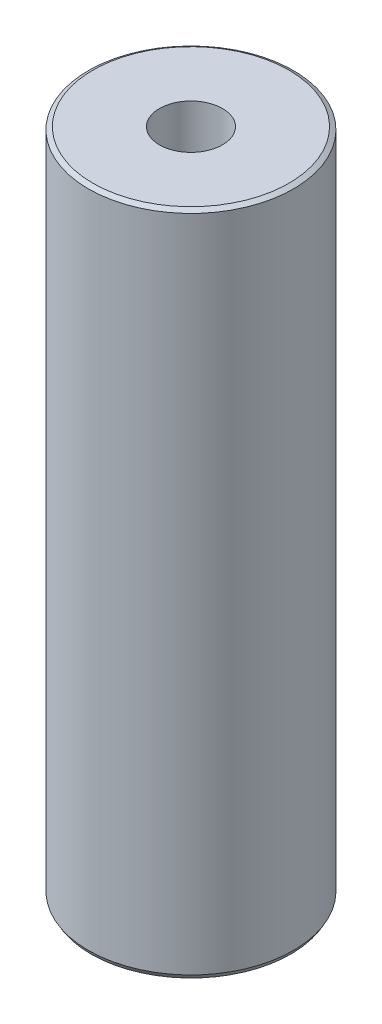
from build123d import *
from OCP.BRepFilletAPI import BRepFilletAPI_MakeChamfer

# Parameters (mm, degrees)
SKETCH1_R           = 57.5
BOSS_EXTRUDE1_DEPTH = 373.817596218
SKETCH2_R           = 17.67627774
CUT_EXTRUDE1_DEPTH  = 383.559923727
CHAMFER1_SIZE       = 1.475221208
CHAMFER1_SIZE2      = 2.538608215


with BuildPart() as part:
    # Sketch1 → Boss-Extrude1 (new body)
    with BuildSketch(Plane(origin=(0, 0, 0), x_dir=(1, 0, 0), z_dir=(0, 1, 0))):
        Circle(SKETCH1_R)
    extrude(amount=BOSS_EXTRUDE1_DEPTH)

    # Sketch2 → Cut-Extrude1 (cut, through all)
    with BuildSketch(Plane(origin=(0, 0, 0), x_dir=(1, 0, 0), z_dir=(0, 1, 0))):
        Circle(SKETCH2_R)
    extrude(amount=CUT_EXTRUDE1_DEPTH, mode=Mode.SUBTRACT)

    # Chamfer1: one chamfer whose edges measure the first distance from different faces: ONE call of the kernel's chamfer builder (chamfer() names one face for all edges)
    chamfer1_edges_1 = [part.edges().sort_by_distance(p)[0] for p in [
        (-57.5, 373.817596218, 0),
    ]]
    chamfer1_side_1 = [part.faces().sort_by_distance(p)[0] for p in [
        (-57.5, 186.908798109, 0),
    ]]
    chamfer1_edges_2 = [part.edges().sort_by_distance(p)[0] for p in [
        (-57.5, 0, 0),
    ]]
    chamfer1_side_2 = [part.faces().sort_by_distance(p)[0] for p in [
        (-55.873654403, 0, 0),
    ]]
    chamfer1 = BRepFilletAPI_MakeChamfer(part.part.solid().wrapped)
    for e in chamfer1_edges_1:
        chamfer1.Add(CHAMFER1_SIZE, CHAMFER1_SIZE2, e.wrapped, chamfer1_side_1[0].wrapped)  # the first distance lies on this face
    for e in chamfer1_edges_2:
        chamfer1.Add(CHAMFER1_SIZE, CHAMFER1_SIZE2, e.wrapped, chamfer1_side_2[0].wrapped)  # the first distance lies on this face
    add(Compound.cast(chamfer1.Shape()), mode=Mode.REPLACE)


solid = part.part
